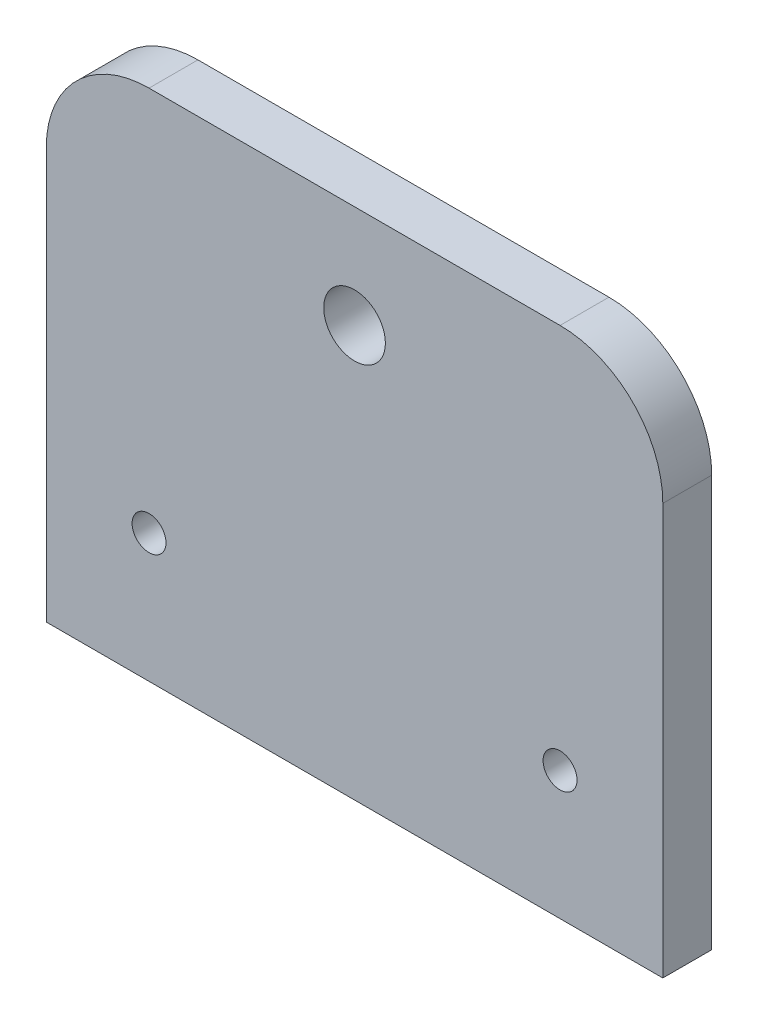
from build123d import *

# Parameters (mm, degrees)
SKETCH1_W           = 60
SKETCH1_H           = 50
BOSS_EXTRUDE1_DEPTH = 4.76
SKETCH2_R           = 1.65
SKETCH2_R_2         = 3
CUT_EXTRUDE1_DEPTH  = 79.247412737
FILLET1_R           = 10


with BuildPart() as part:
    # Sketch1 → Boss-Extrude1 (new body)
    with BuildSketch(Plane.XY):
        with Locations((30, 25)):
            Rectangle(SKETCH1_W, SKETCH1_H)
    extrude(amount=BOSS_EXTRUDE1_DEPTH)

    # Sketch2 → Cut-Extrude1 (cut, through all)
    with BuildSketch(Plane.XY.offset(4.76)):
        with Locations((10, 12.5)):
            Circle(SKETCH2_R)
        with Locations((50, 12.5)):
            Circle(SKETCH2_R)
        with Locations((30, 40)):
            Circle(SKETCH2_R_2)
    extrude(amount=-CUT_EXTRUDE1_DEPTH, mode=Mode.SUBTRACT)

    # Fillet1
    fillet1_edges = [part.edges().sort_by_distance(p)[0] for p in [
        (60, 50, 2.38),
        (0, 50, 2.38),
    ]]
    fillet(fillet1_edges, radius=FILLET1_R)


solid = part.part
